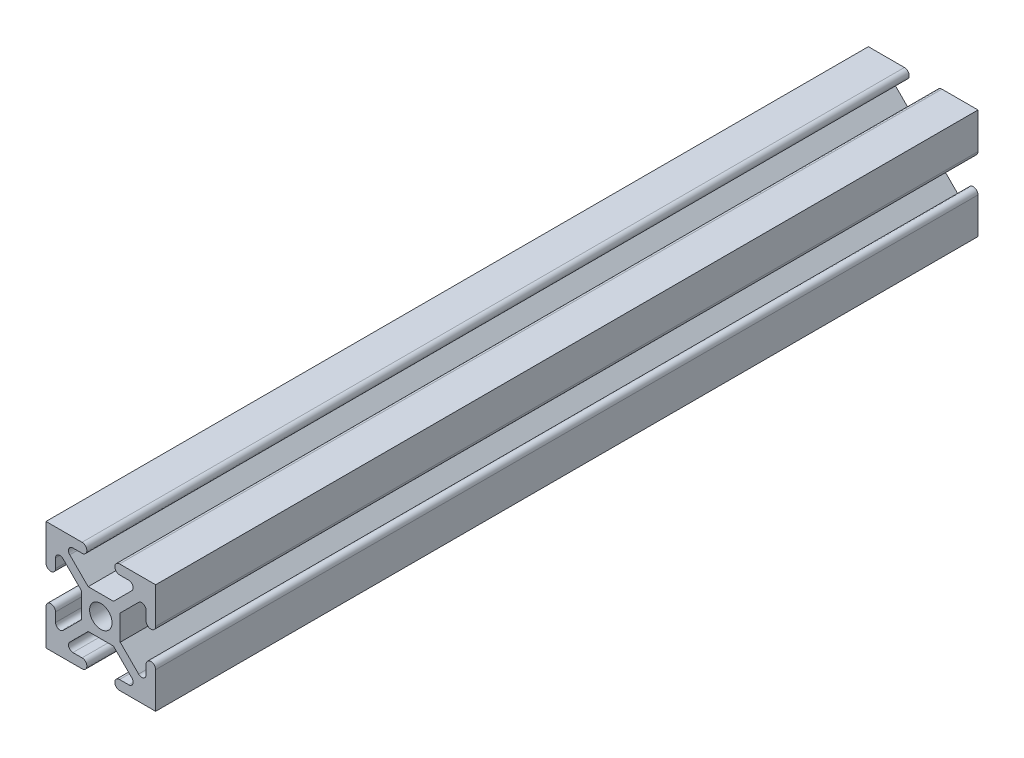
from build123d import *

# Parameters (mm, degrees)
SKETCH1_R           = 2.6035
BOSS_EXTRUDE1_DEPTH = 190.5


with BuildPart() as part:
    # Sketch1 → Boss-Extrude1 (new body)
    with BuildSketch(Plane.XY):
        with BuildLine():
            Line((-12.7, -12.7), (-4.343399971, -12.7))
            ThreePointArc((-4.343399971, -12.7), (-3.238499971, -11.5951), (-4.343399971, -10.4902))
            Line((-4.343399971, -10.4902), (-6.474794456, -10.4902))
            ThreePointArc((-6.474794456, -10.4902), (-7.413456061, -9.863006367), (-7.193214945, -8.75577951))
            Line((-7.193214945, -8.75577951), (-2.933235435, -4.4958))
            Line((-2.933235435, -4.4958), (2.933235435, -4.4958))
            Line((2.933235435, -4.4958), (7.193214945, -8.75577951))
            ThreePointArc((7.193214945, -8.75577951), (7.413456061, -9.863006367), (6.474794456, -10.4902))
            Line((6.474794456, -10.4902), (4.3434, -10.4902))
            ThreePointArc((4.3434, -10.4902), (3.2385, -11.5951), (4.3434, -12.7))
            Line((4.3434, -12.7), (12.7, -12.7))
            Line((12.7, -12.7), (12.7, -4.343399971))
            ThreePointArc((12.7, -4.343399971), (11.5951, -3.238499971), (10.4902, -4.343399971))
            Line((10.4902, -4.343399971), (10.4902, -6.474794456))
            ThreePointArc((10.4902, -6.474794456), (9.863006367, -7.413456061), (8.75577951, -7.193214945))
            Line((8.75577951, -7.193214945), (4.4958, -2.933235435))
            Line((4.4958, -2.933235435), (4.4958, 2.933235435))
            Line((4.4958, 2.933235435), (8.75577951, 7.193214945))
            ThreePointArc((8.75577951, 7.193214945), (9.863006367, 7.413456061), (10.4902, 6.474794456))
            Line((10.4902, 6.474794456), (10.4902, 4.3434))
            ThreePointArc((10.4902, 4.3434), (11.5951, 3.2385), (12.7, 4.3434))
            Line((12.7, 4.3434), (12.7, 12.7))
            Line((12.7, 12.7), (4.343399971, 12.7))
            ThreePointArc((4.343399971, 12.7), (3.238499971, 11.5951), (4.343399971, 10.4902))
            Line((4.343399971, 10.4902), (6.474794456, 10.4902))
            ThreePointArc((6.474794456, 10.4902), (7.413456061, 9.863006367), (7.193214945, 8.75577951))
            Line((7.193214945, 8.75577951), (2.933235435, 4.4958))
            Line((2.933235435, 4.4958), (-2.933235435, 4.4958))
            Line((-2.933235435, 4.4958), (-7.193214945, 8.75577951))
            ThreePointArc((-7.193214945, 8.75577951), (-7.413456061, 9.863006367), (-6.474794456, 10.4902))
            Line((-6.474794456, 10.4902), (-4.3434, 10.4902))
            ThreePointArc((-4.3434, 10.4902), (-3.2385, 11.5951), (-4.3434, 12.7))
            Line((-4.3434, 12.7), (-12.7, 12.7))
            Line((-12.7, 12.7), (-12.7, 4.343399971))
            ThreePointArc((-12.7, 4.343399971), (-11.5951, 3.238499971), (-10.4902, 4.343399971))
            Line((-10.4902, 4.343399971), (-10.4902, 6.474794456))
            ThreePointArc((-10.4902, 6.474794456), (-9.863006367, 7.413456061), (-8.75577951, 7.193214945))
            Line((-8.75577951, 7.193214945), (-4.4958, 2.933235435))
            Line((-4.4958, 2.933235435), (-4.4958, -2.933235435))
            Line((-4.4958, -2.933235435), (-8.75577951, -7.193214945))
            ThreePointArc((-8.75577951, -7.193214945), (-9.863006367, -7.413456061), (-10.4902, -6.474794456))
            Line((-10.4902, -6.474794456), (-10.4902, -4.3434))
            ThreePointArc((-10.4902, -4.3434), (-11.5951, -3.2385), (-12.7, -4.3434))
            Line((-12.7, -4.3434), (-12.7, -12.7))
        make_face()
        Circle(SKETCH1_R, mode=Mode.SUBTRACT)
    extrude(amount=-BOSS_EXTRUDE1_DEPTH)


solid = part.part
